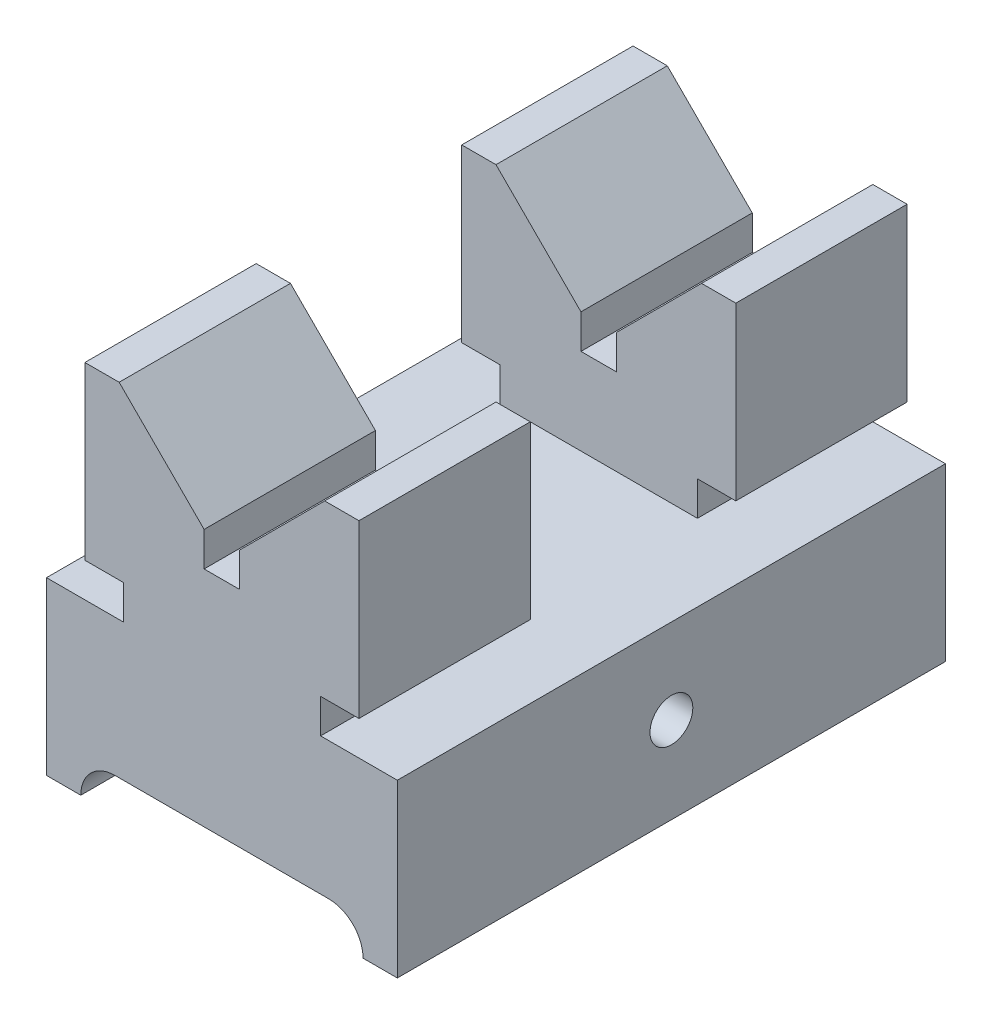
from build123d import *

# Parameters (mm, degrees)
BOSS_EXTRUDE1_DEPTH         = 101.6
FILLET1_R                   = 6.35
FILLET2_R                   = 6.35
F_3_8_16_TAPPED_HOLE3_D     = 7.9375
F_3_8_16_TAPPED_HOLE3_DEPTH = 16.002
F_3_8_16_TAPPED_HOLE3_TIP   = 2.384665582
F_3_8_16_TAPPED_HOLE4_D     = 7.9375
BOSS_EXTRUDE2_DEPTH         = 31.75


with BuildPart() as part:
    # Sketch1 → Boss-Extrude1 (new body)
    with BuildSketch(Plane.XY):
        Polygon((-58.674, 0), (-58.674, 6.35), (-6.35, 6.35), (-6.35, 0), (0, 0), (0, 31.75), (-65.024, 31.75), (-65.024, 0), align=None)
    extrude(amount=BOSS_EXTRUDE1_DEPTH)

    # Fillet1
    fillet1_edges = [part.edges().sort_by_distance(p)[0] for p in [
        (-6.35, 6.35, 50.8),
    ]]
    fillet(fillet1_edges, radius=FILLET1_R - 0.0001)  # a hair under: the kernel refuses the full size

    # Fillet2
    fillet2_edges = [part.edges().sort_by_distance(p)[0] for p in [
        (-58.674, 6.35, 50.8),
    ]]
    fillet(fillet2_edges, radius=FILLET2_R - 0.0001)  # a hair under: the kernel refuses the full size

    # 3/8-16 Tapped Hole3
    with Locations(Plane(origin=(0, 0, 0), x_dir=(-1, 0, 0), z_dir=(0, 0, -1))):
        with Locations((31.75, 22.352)):
            Hole(F_3_8_16_TAPPED_HOLE3_D / 2, depth=F_3_8_16_TAPPED_HOLE3_DEPTH)
            with Locations((0, 0, -(F_3_8_16_TAPPED_HOLE3_DEPTH + F_3_8_16_TAPPED_HOLE3_TIP / 2))):  # 118° drill point
                Cone(0, F_3_8_16_TAPPED_HOLE3_D / 2, F_3_8_16_TAPPED_HOLE3_TIP, mode=Mode.SUBTRACT)

    # 3/8-16 Tapped Hole4 (through all)
    with Locations(Plane(origin=(0, 0, 0), x_dir=(0, 0, -1), z_dir=(1, 0, 0))):
        with Locations((-50.8, 16.002)):
            Hole(F_3_8_16_TAPPED_HOLE4_D / 2)

    # Sketch13 → Boss-Extrude2 (add)
    with BuildSketch(Plane.XY):
        Polygon((-14.224, 31.75), (-14.224, 38.1), (-7.112, 38.1), (-7.112, 69.85), (-13.462, 69.85), (-29.21, 54.102), (-29.21, 47.752), (-35.814, 47.752), (-35.814, 54.102), (-51.562, 69.85), (-57.912, 69.85), (-57.912, 38.1), (-50.8, 38.1), (-50.8, 31.75), align=None)
    boss_extrude2 = extrude(amount=BOSS_EXTRUDE2_DEPTH)

    # Mirror1: Boss-Extrude2 across plane
    add(boss_extrude2.mirror(Plane.XY.offset(50.8)))


solid = part.part
